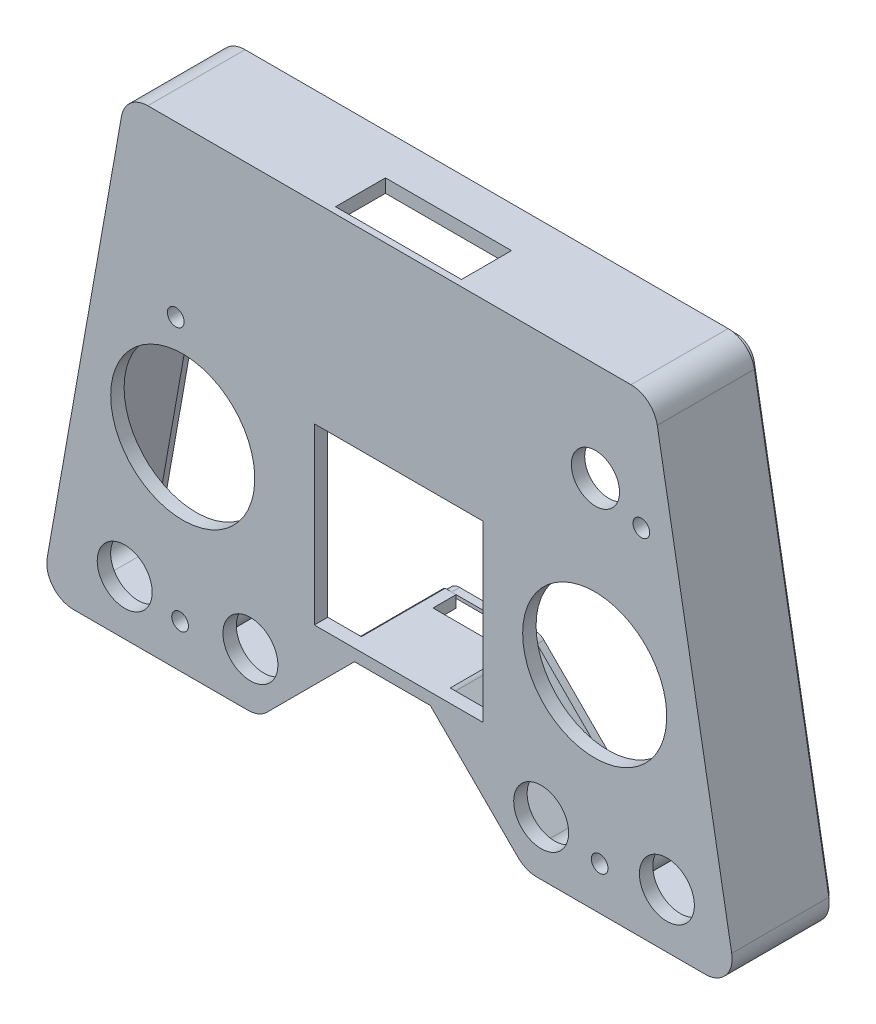
from build123d import *

# Parameters (mm, degrees)
EXTRUDE_14_5_DEPTH                             = 14.5
CUT_EXTRUDE_2_0_DEPTH                          = 12.5
SKETCH_3_R                                     = 3.5
EXTRUDE_508_DEPTH                              = 14.5
SKETCH_4_R                                     = 1.25
CUT_EXTRUDE_M3_2_5_DEPTH                       = 92.95599962
SKETCH_5_R                                     = 10.75
SKETCH_5_R_2                                   = 4.1
SKETCH_5_R_3                                   = 3.6
FRONTPANEL_CONTROL_OPENINGS_DEPTH              = 92.95599962
SKETCH_6_W                                     = 25.2
SKETCH_6_H                                     = 26
OLED_0P96_FROM_HEADER_TOWARD_TYPEC_DEPTH       = 92.95599962
SKETCH_7_W                                     = 9.55
SKETCH_7_H                                     = 3.75
USB_TYPEC_SIDE_OPENING_DEPTH                   = 4
SKETCH_8_W                                     = 4.5
SKETCH_8_H                                     = 6.649955187
SW13_TOGGLE_LEFT_SIDE_OPENING_2026_08_11_DEPTH = 4
SKETCH_9_W                                     = 18.8
SKETCH_9_H                                     = 7.46
NRF24_CORRECTED_2026_08_11_REAR_OPENING_DEPTH  = 4
PCB_0_25_DEPTH                                 = 1.2


with BuildPart() as part:
    # 草图1 → 上壳外形_高14.5 (new body)
    with BuildSketch(Plane.XY):
        with BuildLine():
            Line((-11.561, 23.55), (-22.663, -39.125))
            ThreePointArc((-22.663, -39.125), (-21.79210853, -42.381766358), (-18.737, -43.807))
            Line((-18.737, -43.807), (7.32, -43.807))
            ThreePointArc((7.32, -43.807), (8.845538476, -43.503802025), (10.139, -42.64))
            Line((10.139, -42.64), (23.192, -29.587))
            ThreePointArc((23.192, -29.587), (23.196101883, -29.584104237), (23.201, -29.583))
            Line((23.201, -29.583), (34.512, -29.583))
            ThreePointArc((34.512, -29.583), (34.516898117, -29.584104237), (34.521, -29.587))
            Line((34.521, -29.587), (47.574, -42.64))
            ThreePointArc((47.574, -42.64), (48.867461524, -43.503802025), (50.393, -43.807))
            Line((50.393, -43.807), (75.552, -43.807))
            ThreePointArc((75.552, -43.807), (78.607577407, -42.381973511), (79.479, -39.125))
            Line((79.479, -39.125), (68.376, 23.55))
            ThreePointArc((68.376, 23.55), (67.011779602, 25.910097424), (64.45, 26.842))
            Line((64.45, 26.842), (-7.635, 26.842))
            ThreePointArc((-7.635, 26.842), (-10.196779602, 25.910097424), (-11.561, 23.55))
        make_face()
    extrude(amount=EXTRUDE_14_5_DEPTH)

    # 草图2 → 内部腔体_壁厚2.0 (cut)
    with BuildSketch(Plane.XY):
        with BuildLine():
            Line((-9.591, 23.202), (-20.693, -39.473))
            ThreePointArc((-20.693, -39.473), (-20.259551643, -41.096359474), (-18.737, -41.807))
            Line((-18.737, -41.807), (7.32, -41.807))
            ThreePointArc((7.32, -41.807), (8.080257196, -41.656171016), (8.725, -41.226))
            Line((8.725, -41.226), (21.778, -28.173))
            ThreePointArc((21.778, -28.173), (22.430820844, -27.736473832), (23.201, -27.583))
            Line((23.201, -27.583), (34.512, -27.583))
            ThreePointArc((34.512, -27.583), (35.282179156, -27.736473832), (35.935, -28.173))
            Line((35.935, -28.173), (48.988, -41.226))
            ThreePointArc((48.988, -41.226), (49.632742804, -41.656171016), (50.393, -41.807))
            Line((50.393, -41.807), (75.552, -41.807))
            ThreePointArc((75.552, -41.807), (77.075020422, -41.096566609), (77.509, -39.473))
            Line((77.509, -39.473), (66.406, 23.202))
            ThreePointArc((66.406, 23.202), (65.726213426, 24.377674062), (64.45, 24.842))
            Line((64.45, 24.842), (-7.635, 24.842))
            ThreePointArc((-7.635, 24.842), (-8.911213426, 24.377674062), (-9.591, 23.202))
        make_face()
    extrude(amount=CUT_EXTRUDE_2_0_DEPTH, mode=Mode.SUBTRACT)

    # 草图3 → Extrude 508 (add)
    with BuildSketch(Plane.XY):
        with Locations((-3.469, 1.614)):
            Circle(SKETCH_3_R)
        with Locations((66, 9.107)):
            Circle(SKETCH_3_R)
        with Locations((-2.822, -37.375)):
            Circle(SKETCH_3_R)
        with Locations((59.778, -37.375)):
            Circle(SKETCH_3_R)
    extrude(amount=EXTRUDE_508_DEPTH)

    # 草图4 → M3自攻底孔_直径2.5 (cut, through all)
    with BuildSketch(Plane.XY):
        with Locations((-3.469, 1.614)):
            Circle(SKETCH_4_R)
        with Locations((66, 9.107)):
            Circle(SKETCH_4_R)
        with Locations((-2.822, -37.375)):
            Circle(SKETCH_4_R)
        with Locations((59.778, -37.375)):
            Circle(SKETCH_4_R)
    extrude(amount=CUT_EXTRUDE_M3_2_5_DEPTH, mode=Mode.SUBTRACT)

    # 草图5 → FrontPanel_Control_Openings (cut, through all)
    with BuildSketch(Plane.XY):
        with Locations((-2.427, -13.356)):
            Circle(SKETCH_5_R)
        with Locations((59.041, -13.356)):
            Circle(SKETCH_5_R)
        with Locations((-11.089, -35.723)):
            Circle(SKETCH_5_R_2)
        with Locations((7.669, -35.723)):
            Circle(SKETCH_5_R_2)
        with Locations((51.053, -35.723)):
            Circle(SKETCH_5_R_2)
        with Locations((69.81, -35.723)):
            Circle(SKETCH_5_R_2)
        with Locations((59.147, 12.097)):
            Circle(SKETCH_5_R_3)
    extrude(amount=FRONTPANEL_CONTROL_OPENINGS_DEPTH, mode=Mode.SUBTRACT)

    # 草图6 → OLED_0p96_From_Header_Toward_TypeC (cut, through all)
    with BuildSketch(Plane.XY):
        with Locations((29.805, -14.834)):
            Rectangle(SKETCH_6_W, SKETCH_6_H)
    extrude(amount=OLED_0P96_FROM_HEADER_TOWARD_TYPEC_DEPTH, mode=Mode.SUBTRACT)

    # 草图7 → USB_TypeC_Side_Opening (cut)
    with BuildSketch(Plane.XZ.offset(29.583)):
        with Locations((28.635, 1.575)):
            Rectangle(SKETCH_7_W, SKETCH_7_H)
    extrude(amount=-USB_TYPEC_SIDE_OPENING_DEPTH, mode=Mode.SUBTRACT)

    # 草图8 → SW13_Toggle_Left_Side_Opening_2026-08-11_OBJ (cut)
    with BuildSketch(Plane(origin=(-15.253928165, 2.702020111, 0), x_dir=(0, 0, 1), z_dir=(-0.9846712170135261, 0.17442073954980708, 0))):
        with Locations((1.7, 11.31745025)):
            Rectangle(SKETCH_8_W, SKETCH_8_H)
    extrude(amount=-SW13_TOGGLE_LEFT_SIDE_OPENING_2026_08_11_DEPTH, mode=Mode.SUBTRACT)

    # 草图9 → NRF24_Corrected_2026-08-11_Rear_Opening (cut)
    with BuildSketch(Plane(origin=(0, 26.842, 0), x_dir=(1, 0, 0), z_dir=(0, 1, 0))):
        with Locations((28.81, -9.82)):
            Rectangle(SKETCH_9_W, SKETCH_9_H)
    extrude(amount=-NRF24_CORRECTED_2026_08_11_REAR_OPENING_DEPTH, mode=Mode.SUBTRACT)

    # 草图10 → 内定位舌_避让最新PCB_0.25 (add)
    with BuildSketch(Plane.XY):
        with BuildLine():
            Line((-10.32975, 23.3325), (-21.43175, -39.3425))
            ThreePointArc((-21.43175, -39.3425), (-20.834260447, -41.578387053), (-18.737, -42.557))
            Line((-18.737, -42.557), (7.32, -42.557))
            ThreePointArc((7.32, -42.557), (8.367237668, -42.349032638), (9.25525, -41.75625))
            Line((9.25525, -41.75625), (22.30825, -28.70325))
            ThreePointArc((22.30825, -28.70325), (22.71780134, -28.429335473), (23.201, -28.333))
            Line((23.201, -28.333), (34.512, -28.333))
            ThreePointArc((34.512, -28.333), (34.99519866, -28.429335473), (35.40475, -28.70325))
            Line((35.40475, -28.70325), (48.45775, -41.75625))
            ThreePointArc((48.45775, -41.75625), (49.345762332, -42.349032638), (50.393, -42.557))
            Line((50.393, -42.557), (75.552, -42.557))
            ThreePointArc((75.552, -42.557), (77.64972928, -41.578594198), (78.24775, -39.3425))
            Line((78.24775, -39.3425), (67.14475, 23.3325))
            ThreePointArc((67.14475, 23.3325), (66.208300734, 24.952332815), (64.45, 25.592))
            Line((64.45, 25.592), (-7.635, 25.592))
            ThreePointArc((-7.635, 25.592), (-9.393300734, 24.952332815), (-10.32975, 23.3325))
        make_face()
        with BuildLine():
            Line((-9.83725, 23.2455), (-20.93925, -39.4295))
            ThreePointArc((-20.93925, -39.4295), (-20.451121237, -41.257035333), (-18.737, -42.057))
            Line((-18.737, -42.057), (7.32, -42.057))
            ThreePointArc((7.32, -42.057), (8.175917351, -41.887124888), (8.90175, -41.40275))
            Line((8.90175, -41.40275), (21.95475, -28.34975))
            ThreePointArc((21.95475, -28.34975), (22.526481009, -27.967427712), (23.201, -27.833))
            Line((23.201, -27.833), (34.512, -27.833))
            ThreePointArc((34.512, -27.833), (35.186518991, -27.967427712), (35.75825, -28.34975))
            Line((35.75825, -28.34975), (48.81125, -41.40275))
            ThreePointArc((48.81125, -41.40275), (49.537082649, -41.887124888), (50.393, -42.057))
            Line((50.393, -42.057), (75.552, -42.057))
            ThreePointArc((75.552, -42.057), (77.266590039, -41.257242472), (77.75525, -39.4295))
            Line((77.75525, -39.4295), (66.65225, 23.2455))
            ThreePointArc((66.65225, 23.2455), (65.886909193, 24.569226978), (64.45, 25.092))
            Line((64.45, 25.092), (-7.635, 25.092))
            ThreePointArc((-7.635, 25.092), (-9.071909193, 24.569226978), (-9.83725, 23.2455))
        make_face(mode=Mode.SUBTRACT)
    extrude(amount=-PCB_0_25_DEPTH)


solid = part.part
